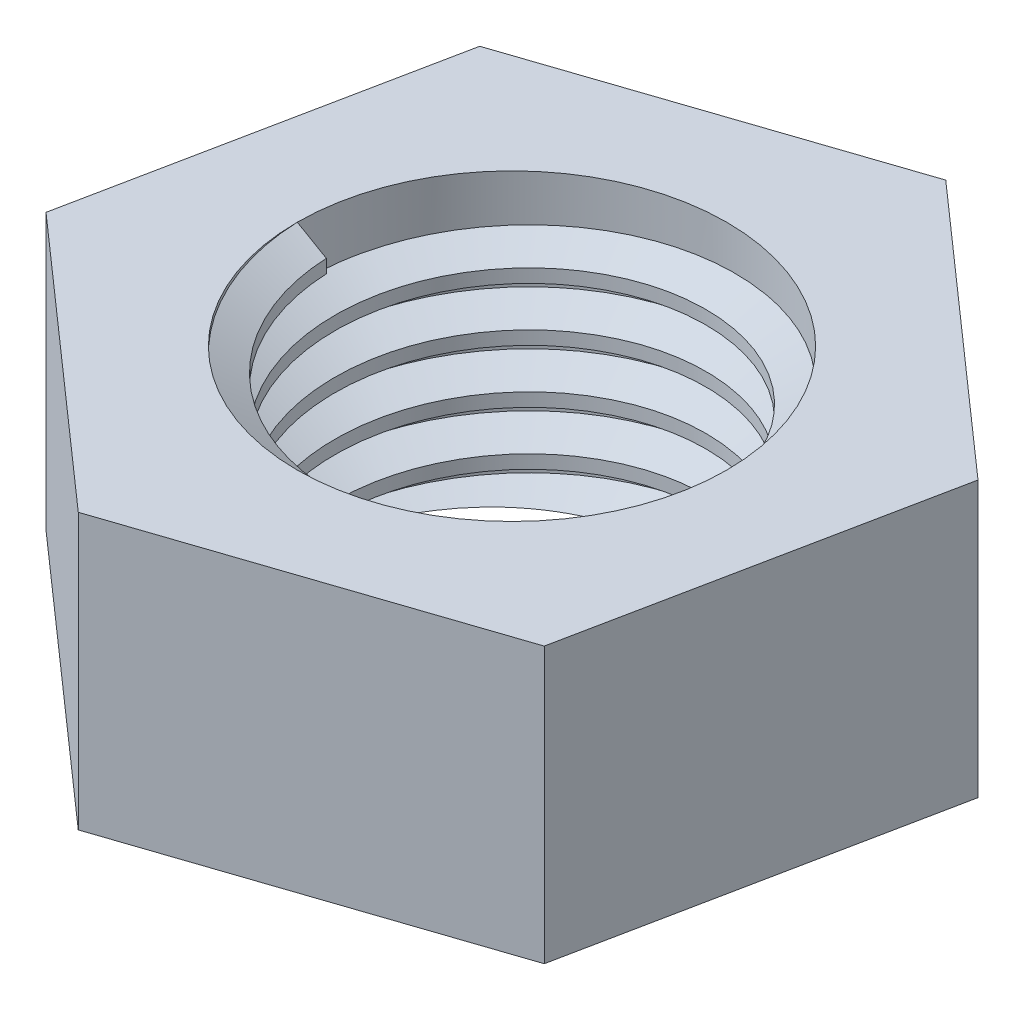
from build123d import *

# Parameters (mm, degrees)
SKETCH1_R           = 12.7
BOSS_EXTRUDE1_DEPTH = 16.271875
THREAD1_PITCH       = 3.175
SKETCH4_R           = 15.871911633
CUT_EXTRUDE1_DEPTH  = 9.413875


with BuildPart() as part:
    # Sketch1 → Boss-Extrude1 (new body)
    with BuildSketch(Plane(origin=(0, 0, 0), x_dir=(1, 0, 0), z_dir=(0, 1, 0))):
        Polygon((20.636580853, 6.926283922), (4.319952596, 21.334945227), (-16.316628256, 14.408661305), (-20.636580853, -6.926283922), (-4.319952596, -21.334945227), (16.316628256, -14.408661305), align=None)
        with Locations(Location((0, 0, 0), (0, 0, 270))):
            Circle(SKETCH1_R, mode=Mode.SUBTRACT)
    extrude(amount=BOSS_EXTRUDE1_DEPTH)

    # Thread1: the profile of Thread Profile1 profile screwed along a left-hand helix of 5.125 turns, 12 arcs to a turn; built about Z, then put on its axis
    thread1_z = Axis((0, 0, 0), (0, 0, 1))
    thread1_corners = [(12.7003, 0, -0.000173205), (12.7003, 0, 2.778298196), (10.981480847, 0, 1.785937496), (10.981480847, 0, 0.992187496)]
    with BuildLine(mode=Mode.PRIVATE) as thread1_profile:
        Line(thread1_corners[0], thread1_corners[1])
        Line(thread1_corners[1], thread1_corners[2])
        Line(thread1_corners[2], thread1_corners[3])
        Line(thread1_corners[3], thread1_corners[0])
    thread1_cap = Face(thread1_profile.wire())
    thread1_turn_angles = [0, -15, -30, -45, -60, -75, -90, -105, -120, -135, -150, -165, -180, -195, -210, -225, -240, -255, -270, -285, -300, -315, -330, -345, -360]
    thread1_turn_weights = [1, 0.9659258262890683, 1, 0.9659258262890683, 1, 0.9659258262890683, 1, 0.9659258262890683, 1, 0.9659258262890683, 1, 0.9659258262890683, 1, 0.9659258262890683, 1, 0.9659258262890683, 1, 0.9659258262890683, 1, 0.9659258262890683, 1, 0.9659258262890683, 1, 0.9659258262890683, 1]
    thread1_turn_rails = [Edge.make_bspline([Vector(p[0], p[1], 0).rotate(thread1_z, thread1_turn_angles[k]) / thread1_turn_weights[k] + Vector(0, 0, p[2] + -THREAD1_PITCH * thread1_turn_angles[k] / 360) for k in range(25)], [0, 0, 0, 1, 1, 2, 2, 3, 3, 4, 4, 5, 5, 6, 6, 7, 7, 8, 8, 9, 9, 10, 10, 11, 11, 12, 12, 12], 2, thread1_turn_weights) for p in thread1_corners]
    thread1_turn_sides = [Face.make_surface_from_curves(thread1_turn_rails[p[0]], thread1_turn_rails[p[1]]) for p in [(0, 1), (1, 2), (2, 3), (3, 0)]]
    thread1_turn = Solid(Shell([*thread1_turn_sides, thread1_cap, thread1_cap.rotate(thread1_z, -360).moved(Location((0, 0, -THREAD1_PITCH * -360 / 360)))]))
    thread1_last_angles = [-1800, -1815, -1830, -1837.5, -1845]
    thread1_last_weights = [1, 0.9659258262890683, 1, 0.9914448613738107, 1]
    thread1_last_rails = [Edge.make_bspline([Vector(p[0], p[1], 0).rotate(thread1_z, thread1_last_angles[k]) / thread1_last_weights[k] + Vector(0, 0, p[2] + -THREAD1_PITCH * thread1_last_angles[k] / 360) for k in range(5)], [0, 0, 0, 1, 1, 2, 2, 2], 2, thread1_last_weights) for p in thread1_corners]
    thread1_last_sides = [Face.make_surface_from_curves(thread1_last_rails[p[0]], thread1_last_rails[p[1]]) for p in [(0, 1), (1, 2), (2, 3), (3, 0)]]
    thread1_last = Solid(Shell([*thread1_last_sides, thread1_cap.rotate(thread1_z, -1800).moved(Location((0, 0, -THREAD1_PITCH * -1800 / 360))), thread1_cap.rotate(thread1_z, -1845).moved(Location((0, 0, -THREAD1_PITCH * -1845 / 360)))]))
    thread1_each = [*[thread1_turn.moved(Location((0, 0, THREAD1_PITCH * i))) for i in range(5)], thread1_last]
    add(Plane(origin=(0, 16.271875, 0), x_dir=(-1, 0, 0), z_dir=(0, -1, 0)) * Compound([thread1_each[i] for i in range(0, 6, 2)]))
    add(Plane(origin=(0, 16.271875, 0), x_dir=(-1, 0, 0), z_dir=(0, -1, 0)) * Compound([thread1_each[i] for i in range(1, 6, 2)]))

    # Sketch4 → Cut-Extrude1 (cut)
    with BuildSketch(Plane.XZ):
        Circle(SKETCH4_R)
    extrude(amount=CUT_EXTRUDE1_DEPTH, mode=Mode.SUBTRACT)


solid = part.part
